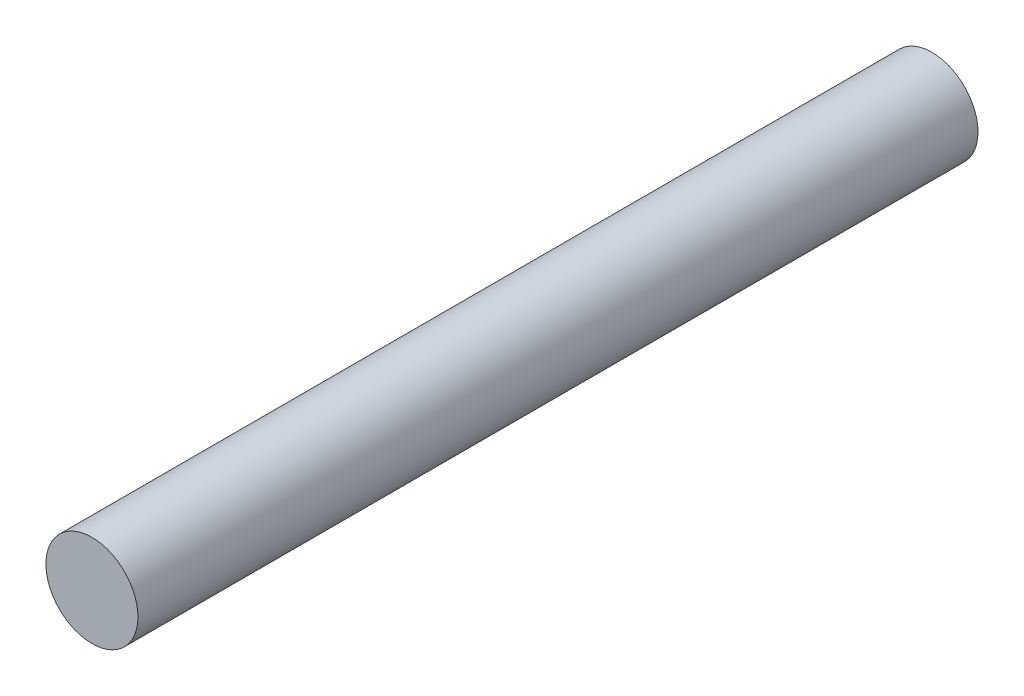
from build123d import *

# Parameters (mm, degrees)
SKETCH1_R           = 4
BOSS_EXTRUDE1_DEPTH = 60
BOSS_EXTRUDE2_START = -13
SKETCH2_R           = 4
BOSS_EXTRUDE2_DEPTH = 13


with BuildPart() as part:
    # Sketch1 → Boss-Extrude1 (new body)
    with BuildSketch(Plane.XY):
        Circle(SKETCH1_R)
    extrude(amount=BOSS_EXTRUDE1_DEPTH)

    # Sketch2 → Boss-Extrude2 (add)
    with BuildSketch(Plane.XY.offset(BOSS_EXTRUDE2_START)):
        Circle(SKETCH2_R)
    extrude(amount=BOSS_EXTRUDE2_DEPTH)


solid = part.part
